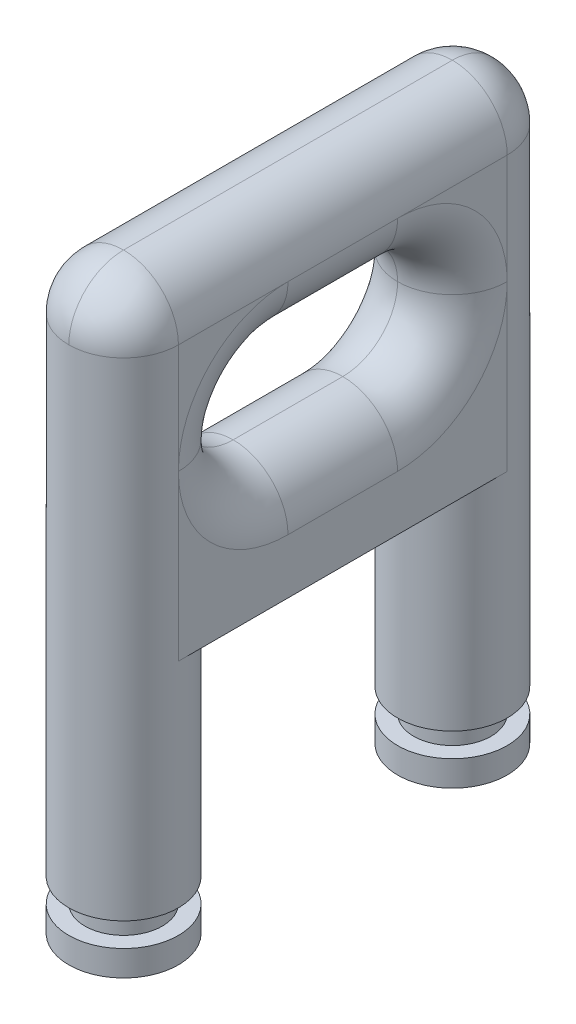
from build123d import *

# Parameters (mm, degrees)
BOSS_EXTRUDE1_DEPTH      = 3.175
BOSS_EXTRUDE1_DEPTH_BACK = 3.175
SKETCH1_W                = 25.4
SKETCH1_H                = 19.05
SKETCH1_W_2              = 12.7
SKETCH1_H_2              = 6.35
FILLET1_R                = 3.175
SKETCH3_R                = 3.175
BOSS_EXTRUDE2_DEPTH      = 15.24
SKETCH6_W                = 0.932989676
SKETCH6_H                = 1.384301363


with BuildPart() as part:
    # Sketch1 → Boss-Extrude1 (new, two sides: drawn at the far end of the back side and taken through both)
    with BuildSketch(Plane(origin=(0, 0, 0), x_dir=(0, 0, -1), z_dir=(1, 0, 0)).offset(-BOSS_EXTRUDE1_DEPTH_BACK)):
        Rectangle(SKETCH1_W, SKETCH1_H)
        Rectangle(SKETCH1_W_2, SKETCH1_H_2, mode=Mode.SUBTRACT)
    extrude(amount=BOSS_EXTRUDE1_DEPTH + BOSS_EXTRUDE1_DEPTH_BACK)

    # Fillet1
    fillet1_edges = [part.edges().sort_by_distance(p)[0] for p in [
        (-3.175, 0, -12.7),
        (-3.175, 9.525, 0),
        (-3.175, 0, 6.35),
        (0, -3.175, 6.35),
        (-3.175, 3.175, 0),
        (0, 3.175, 6.35),
        (-3.175, 0, -6.35),
        (0, 3.175, -6.35),
        (-3.175, -3.175, 0),
        (0, -3.175, -6.35),
        (3.175, 0, 12.7),
        (3.175, 0, -12.7),
        (3.175, 9.525, 0),
        (3.175, 0, 6.35),
        (3.175, -3.175, 0),
        (3.175, 0, -6.35),
        (3.175, 3.175, 0),
        (-3.175, 0, 12.7),
        (0, 9.525, 12.7),
        (0, 9.525, -12.7),
    ]]
    fillet(fillet1_edges, radius=FILLET1_R - 0.0001)  # a hair under: the kernel refuses the full size

    # Sketch3 → Boss-Extrude2 (add)
    with BuildSketch(Plane.XZ.offset(9.525)):
        with Locations(Location((0, -9.525, 0), (0, 0, 270))):
            Circle(SKETCH3_R)
    boss_extrude2 = extrude(amount=BOSS_EXTRUDE2_DEPTH)

    # Cut-Sweep1: sweep along a curve in space
    with BuildLine() as cut_sweep1_path:
        ThreePointArc((0, -24.765, -12.7), (2.24506403, -24.765, -11.77006403), (3.175, -24.765, -9.525))
        ThreePointArc((3.175, -24.765, -9.525), (2.24506403, -24.765, -7.27993597), (0, -24.765, -6.35))
        ThreePointArc((0, -24.765, -6.35), (-2.24506403, -24.765, -7.27993597), (-3.175, -24.765, -9.525))
        ThreePointArc((-3.175, -24.765, -9.525), (-2.24506403, -24.765, -11.77006403), (0, -24.765, -12.7))
    # Sketch6 → Cut-Sweep1 (sweep, cut)
    with BuildSketch(Plane(origin=(0, 0, 0), x_dir=(0, 0, -1), z_dir=(1, 0, 0))):
        with Locations((12.233505162, -22.592816152)):
            Rectangle(SKETCH6_W, SKETCH6_H)
    cut_sweep1 = sweep(path=cut_sweep1_path.line, mode=Mode.SUBTRACT)

    # Mirror1: Boss-Extrude2, Cut-Sweep1 across plane
    add(boss_extrude2.mirror(Plane.XY))
    add(cut_sweep1.mirror(Plane.XY), mode=Mode.SUBTRACT)


solid = part.part
